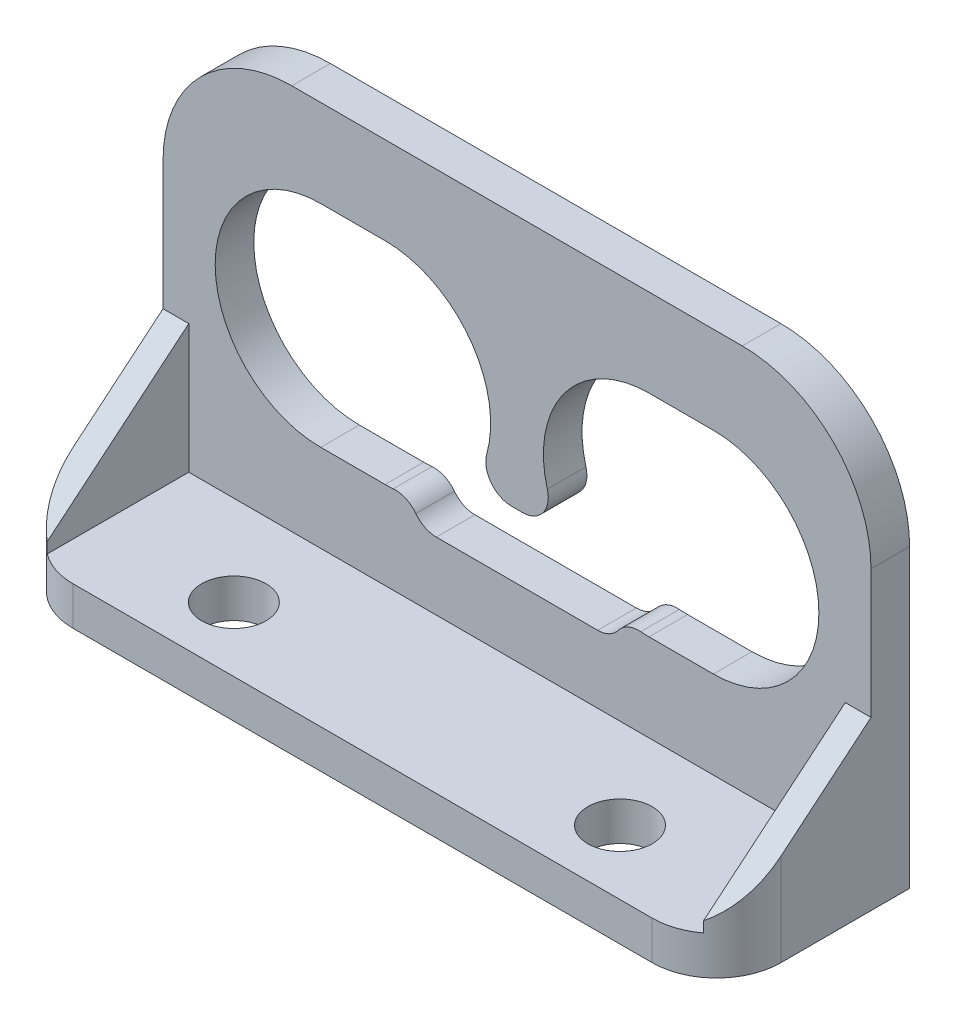
from build123d import *

# Parameters (mm, degrees)
SKETCH1_W           = 55
SKETCH1_H           = 15
BOSS_EXTRUDE1_DEPTH = 3
SKETCH2_W           = 55
SKETCH2_H           = 3
BOSS_EXTRUDE2_DEPTH = 30
CUT_EXTRUDE1_DEPTH  = 30
SKETCH4_R           = 2.5
CUT_EXTRUDE2_DEPTH  = 30
BOSS_EXTRUDE3_DEPTH = 2
FILLET1_R           = 10
SKETCH6_W           = 15
SKETCH6_H           = 5
CUT_EXTRUDE3_DEPTH  = 10
FILLET2_R           = 2
FILLET3_R           = 2
FILLET4_R           = 2
FILLET5_R           = 5


with BuildPart() as part:
    # Sketch1 → Boss-Extrude1 (new body)
    with BuildSketch(Plane(origin=(0, 0, 0), x_dir=(1, 0, 0), z_dir=(0, 1, 0))):
        Rectangle(SKETCH1_W, SKETCH1_H)
    extrude(amount=BOSS_EXTRUDE1_DEPTH)

    # Sketch2 → Boss-Extrude2 (add)
    with BuildSketch(Plane(origin=(0, 3, 0), x_dir=(1, 0, 0), z_dir=(0, 1, 0))):
        with Locations((0, 6)):
            Rectangle(SKETCH2_W, SKETCH2_H)
    extrude(amount=BOSS_EXTRUDE2_DEPTH)

    # Sketch3 → Cut-Extrude1 (cut)
    with BuildSketch(Plane.XY.offset(-4.5)):
        with BuildLine():
            Line((-15.25, 26.2), (-10.25, 26.2))
            ThreePointArc((-10.25, 26.2), (-2.05, 18), (-10.25, 9.8))
            Line((-10.25, 9.8), (-15.25, 9.8))
            ThreePointArc((-15.25, 9.8), (-23.45, 18), (-15.25, 26.2))
        make_face()
        with BuildLine():
            Line((15.25, 26.2), (10.25, 26.2))
            ThreePointArc((10.25, 26.2), (2.05, 18), (10.25, 9.8))
            Line((10.25, 9.8), (15.25, 9.8))
            ThreePointArc((15.25, 9.8), (23.45, 18), (15.25, 26.2))
        make_face()
    extrude(amount=-CUT_EXTRUDE1_DEPTH, mode=Mode.SUBTRACT)

    # Sketch4 → Cut-Extrude2 (cut)
    with BuildSketch(Plane(origin=(0, 3, 0), x_dir=(1, 0, 0), z_dir=(0, 1, 0))):
        with Locations(Location((-15, -2.5, 0), (0, 0, 270))):
            Circle(SKETCH4_R)
        with Locations(Location((15, -2.5, 0), (0, 0, 270))):
            Circle(SKETCH4_R)
    extrude(amount=-CUT_EXTRUDE2_DEPTH, mode=Mode.SUBTRACT)

    # Sketch5 → Boss-Extrude3 (add)
    with BuildSketch(Plane.ZY.offset(27.5)):
        Polygon((7.5, 3), (-4.5, 3), (-4.5, 13), align=None)
    boss_extrude3 = extrude(amount=-BOSS_EXTRUDE3_DEPTH)

    # Mirror1: Boss-Extrude3 across plane
    add(boss_extrude3.mirror(Plane(origin=(0, 0, 0), x_dir=(0, 0, 1), z_dir=(1, 0, 0))))

    # Fillet1
    fillet1_edges = [part.edges().sort_by_distance(p)[0] for p in [
        (-27.5, 33, -6),
        (27.5, 33, -6),
    ]]
    fillet(fillet1_edges, radius=FILLET1_R)

    # Sketch6 → Cut-Extrude3 (cut)
    with BuildSketch(Plane(origin=(0, 0, -7.5), x_dir=(-1, 0, 0), z_dir=(0, 0, -1))):
        with Locations((0, 10.75)):
            Rectangle(SKETCH6_W, SKETCH6_H)
    extrude(amount=-CUT_EXTRUDE3_DEPTH, mode=Mode.SUBTRACT)

    # Fillet2
    # the kernel refuses this fillet: 2 mm, written as the material it takes off along each edge
    with BuildSketch(Plane(origin=(-7.5, 10.274878642, -12.896978856), x_dir=(0, -1, 0), z_dir=(0, 0, 1))) as fillet2_piece_1:
        with BuildLine():
            CenterArc((2.443897749, -1.9556132), FILLET2_R, 102.093612403, 82.373166868)
            Line((0.449972434, -2.111375318), (0.410093928, -2.11449056))
            ThreePointArc((0.410093928, -2.11449056), (0.255650409, -1.049152563), (-0.037683519, -0.013414634))
            Line((-0.037683519, -0.013414634), (0, 0.04))
            ThreePointArc((0, 0.04), (1.012439321, 0.04), (2.01649826, 0.039112264))
            Line((2.01649826, 0.039112264), (2.024878642, 0))
        make_face()
    extrude(amount=13.793957711, mode=Mode.SUBTRACT)
    with BuildSketch(Plane(origin=(7.5, 10.274878642, -12.896978856), x_dir=(0.9780357557406035, -0.2084371859647568, 0), z_dir=(0, 0, 1))) as fillet2_piece_2:
        with BuildLine():
            CenterArc((2.422058804, -1.98259687), FILLET2_R, 97.564003787, 82.373166868)
            Line((0.422060006, -1.980403713), (0.38206003, -1.980359849))
            ThreePointArc((0.38206003, -1.980359849), (0.171908573, -0.998539344), (-0.03912143, -0.008337487))
            Line((-0.03912143, -0.008337487), (0.005265345, 0.039651937))
            ThreePointArc((0.005265345, 0.039651937), (1.079395771, -0.031352833), (2.153526197, 0.039651937))
            Line((2.153526197, 0.039651937), (2.158791542, 0))
        make_face()
    extrude(amount=13.793957711, mode=Mode.SUBTRACT)

    # Fillet3
    fillet3_edges = [part.edges().sort_by_distance(p)[0] for p in [
        (-3.565877021, 13.25, -6),
        (3.565877021, 13.25, -6),
    ]]
    fillet(fillet3_edges, radius=FILLET3_R)

    # Fillet4
    fillet4_edges = [part.edges().sort_by_distance(p)[0] for p in [
        (-7.5, 8.25, -6),
        (7.5, 8.25, -6),
    ]]
    fillet(fillet4_edges, radius=FILLET4_R)

    # Fillet5
    # the kernel refuses this fillet: 5 mm, written as the material it takes off along each edge
    with BuildSketch(Plane(origin=(27.5, -12.5, 7.5), x_dir=(0, 0, -1), z_dir=(0, 1, 0))) as fillet5_piece_1:
        with BuildLine():
            CenterArc((FILLET5_R, FILLET5_R), FILLET5_R, 180, 90)
            Line((0, FILLET5_R), (0, 0))
            Line((0, 0), (FILLET5_R, 0))
        make_face()
    extrude(amount=28, mode=Mode.SUBTRACT)
    with BuildSketch(Plane(origin=(-27.5, -12.5, 7.5), x_dir=(0, 0, -1), z_dir=(0, 1, 0))) as fillet5_piece_2:
        with BuildLine():
            CenterArc((FILLET5_R, -FILLET5_R), FILLET5_R, 90, 90)
            Line((0, -FILLET5_R), (0, 0))
            Line((0, 0), (FILLET5_R, 0))
        make_face()
    extrude(amount=28, mode=Mode.SUBTRACT)


solid = part.part
